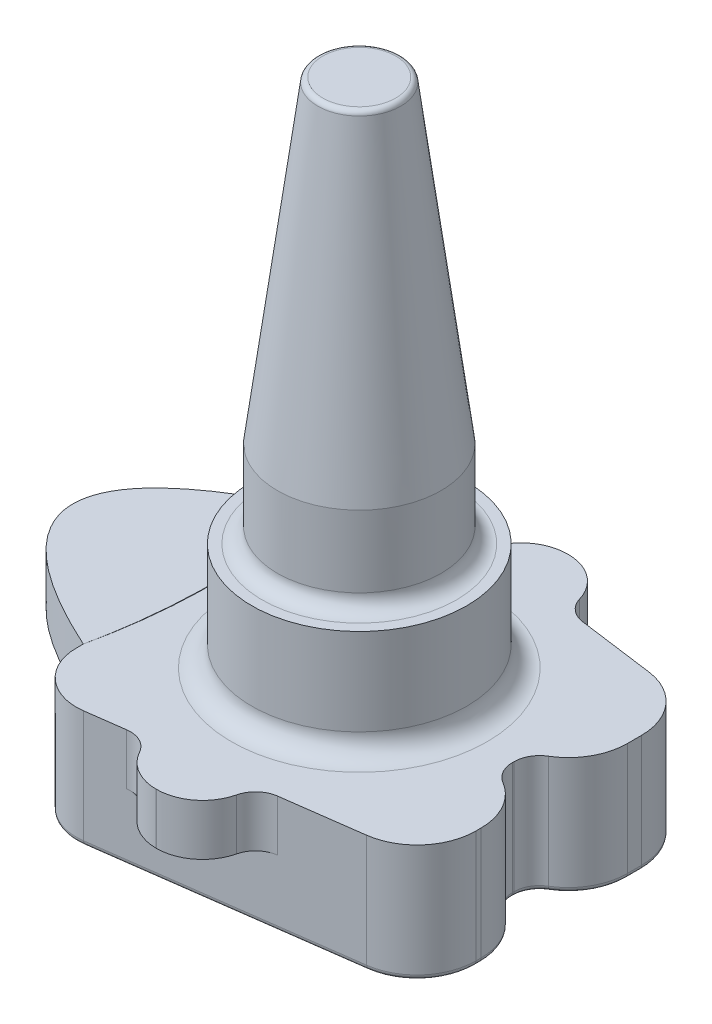
from build123d import *

# Parameters (mm, degrees)
ESBO_O2_OUTSIDE_W        = 213.508
ESBO_O2_OUTSIDE_H        = 213.508
CORTE_EXTRUS_O2_DEPTH    = 177.104428981
ESBO_O3_R                = 106.5
CORTE_EXTRUS_O3_DEPTH    = 140.951031327
FILETE1_R                = 10
ESBO_O4_W                = 8
ESBO_O4_H                = 4.25
CORTE_EXTRUS_O4_DEPTH    = 140.587965081
FILETE2_R                = 11.5
FILETE3_R                = 11.5
FILETE4_R                = 5
FILETE5_R                = 5
FILETE6_R                = 11.5
FILETE7_R                = 4
FILETE8_R                = 3
FILETE10_R               = 1
ESBO_O5_R                = 20.5
CORTE_EXTRUS_O6_DEPTH    = 2.5
CHANFRO1_SIZE            = 2
ESBO_O6_W                = 10
ESBO_O6_H                = 20
CORTE_EXTRUS_O7_DEPTH    = 10
CHANFRO2_SIZE            = 1
RESSALTO_EXTRUS_O2_DEPTH = 23
CORTE_EXTRUS_O10_DEPTH   = 13
CORTE_EXTRUS_O11_DEPTH   = 13
FILETE11_R               = 9
FILETE12_R               = 5
FILETE15_R               = 5
FILETE16_R               = 9
FILETE17_R               = 5
FILETE18_R               = 5
RESSALTO_EXTRUS_O4_DEPTH = 23
CORTE_EXTRUS_O12_DEPTH   = 13
FILETE20_R               = 1


with BuildPart() as part:
    # Esboço1 → Revolução1 (revolve)
    with BuildSketch(Plane.XY, mode=Mode.PRIVATE) as revolu_o1_sk:
        Polygon((17.384649235, 86.73567042), (25.384649235, 86.73567042), (33.384649235, 24.73567042), (33.384649235, 7.73567042), (38.384649235, 7.73567042), (38.384649235, -13.26432958), (97.384649235, -13.26432958), (97.384649235, -36.26432958), (17.384649235, -36.26432958), align=None)
    revolve(revolu_o1_sk.sketch.rotate(Axis((17.384649235, 86.73567042, 0), (0, -1, 0)), 180), axis=Axis((17.384649235, 86.73567042, 0), (0, -1, 0)))

    # Esboço2 outside → Corte-extrusão2 (cut, through all)
    with BuildSketch(Plane.XZ.offset(36.26432958)):
        with Locations((17.385, 0)):
            Rectangle(ESBO_O2_OUTSIDE_W, ESBO_O2_OUTSIDE_H)
        Polygon((56.384649235, 26.25), (56.384649235, -26.25), (-13.615350765, -35.75), (-13.615350765, 35.75), align=None, mode=Mode.SUBTRACT)
    extrude(amount=-CORTE_EXTRUS_O2_DEPTH, mode=Mode.SUBTRACT)

    # Esboço3 → Corte-extrusão3 (cut, through all)
    with BuildSketch(Plane.XZ.offset(36.26432958)):
        with Locations((-117.615350765, 0)):
            Circle(ESBO_O3_R)
    extrude(amount=-CORTE_EXTRUS_O3_DEPTH, mode=Mode.SUBTRACT)

    # Filete1
    filete1_edges = [part.edges().sort_by_distance(p)[0] for p in [
        (-13.615350765, -24.76432958, -35.75),
        (-13.615350765, -24.76432958, 35.75),
    ]]
    fillet(filete1_edges, radius=FILETE1_R)

    # Esboço4 → Corte-extrusão4 (cut, through all)
    with BuildSketch(Plane.XZ.offset(36.26432958)):
        with Locations((52.384649235, 2.125)):
            Rectangle(ESBO_O4_W, ESBO_O4_H)
        with Locations((52.384649235, -2.125)):
            Rectangle(ESBO_O4_W, ESBO_O4_H)
    extrude(amount=-CORTE_EXTRUS_O4_DEPTH, mode=Mode.SUBTRACT)

    # Filete2
    filete2_edges = [part.edges().sort_by_distance(p)[0] for p in [
        (56.384649235, -24.76432958, 26.25),
    ]]
    fillet(filete2_edges, radius=FILETE2_R)

    # Filete3
    # the kernel refuses this fillet: 11.5 mm, written as the material it takes off along each edge
    with BuildSketch(Plane(origin=(56.384649235, -63.650457456, 4.25), x_dir=(0, 0, 1), z_dir=(0, 1, 0))) as filete3_piece_1:
        with BuildLine():
            CenterArc((10.95445115, -11.5), FILETE3_R, 90, 72.281068127)
            Line((0, -8), (-0.219089023, -7.93))
            ThreePointArc((-0.219089023, -7.93), (-0.23, -4), (-0.23, 0))
            Line((-0.23, 0), (0, 0.23))
            Line((0, 0.23), (10.95445115, 0.23))
            Line((10.95445115, 0.23), (10.95445115, 0))
        make_face()
    extrude(amount=77.772255751, mode=Mode.SUBTRACT)

    # Filete4
    filete4_edges = [part.edges().sort_by_distance(p)[0] for p in [
        (48.384649235, -24.76432958, 4.25),
    ]]
    fillet(filete4_edges, radius=FILETE4_R)

    # Filete5
    filete5_edges = [part.edges().sort_by_distance(p)[0] for p in [
        (48.384649235, -24.76432958, -4.25),
    ]]
    fillet(filete5_edges, radius=FILETE5_R)

    # Filete6
    filete6_edges = [part.edges().sort_by_distance(p)[0] for p in [
        (56.384649235, -24.76432958, -26.25),
        (56.384649235, -24.76432958, -4.25),
    ]]
    fillet(filete6_edges, radius=FILETE6_R)

    # Filete7
    filete7_edges = [part.edges().sort_by_distance(p)[0] for p in [
        (38.384649235, -13.26432958, 0),
    ]]
    fillet(filete7_edges, radius=FILETE7_R)

    # Filete8
    filete8_edges = [part.edges().sort_by_distance(p)[0] for p in [
        (33.384649235, 7.73567042, 0),
    ]]
    fillet(filete8_edges, radius=FILETE8_R)

    # Filete10
    filete10_edges = [part.edges().sort_by_distance(p)[0] for p in [
        (54.894114452, -36.26432958, 9.542242565),
        (49.032707836, -36.26432958, 3.524145346),
        (56.384649235, -36.26432958, -14.798713755),
        (49.032707836, -36.26432958, -1.71182982),
        (54.894114452, -36.26432958, -7.729927039),
        (53.545918618, -36.26432958, -23.770502568),
        (-13.615350765, -36.26432958, -23.620662492),
        (-11.115350765, -36.26432958, 0),
        (-13.615350765, -36.26432958, 23.620662492),
        (22.080325057, -36.26432958, -30.905586853),
        (-10.193794837, -36.26432958, 31.832724085),
        (-10.193794837, -36.26432958, -31.832724085),
        (22.080325057, -36.26432958, 30.905586853),
        (53.545918618, -36.26432958, 23.770502568),
        (56.384649235, -36.26432958, 15.704871518),
        (48.384649235, -36.26432958, 0.906157763),
    ]]
    fillet(filete10_edges, radius=FILETE10_R)

    # Esboço5 → Corte-extrusão6 (cut)
    with BuildSketch(Plane.XZ.offset(36.26432958)):
        with Locations((18.634649235, 0.375)):
            Circle(ESBO_O5_R)
    extrude(amount=-CORTE_EXTRUS_O6_DEPTH, mode=Mode.SUBTRACT)

    # Chanfro1
    chanfro1_edges = [part.edges().sort_by_distance(p)[0] for p in [
        (-1.865350765, -33.76432958, 0.375),
    ]]
    chamfer(chanfro1_edges, length=CHANFRO1_SIZE)

    # Esboço6 → Corte-extrusão7 (cut)
    with BuildSketch(Plane.XZ.offset(33.76432958)):
        with Locations((18.634649235, 0.375)):
            Rectangle(ESBO_O6_W, ESBO_O6_H)
    extrude(amount=-CORTE_EXTRUS_O7_DEPTH, mode=Mode.SUBTRACT)

    # Chanfro2
    chanfro2_edges = [part.edges().sort_by_distance(p)[0] for p in [
        (13.634649235, -33.76432958, 0.375),
        (18.634649235, -33.76432958, -9.625),
        (23.634649235, -33.76432958, 0.375),
        (18.634649235, -33.76432958, 10.375),
    ]]
    chamfer(chanfro2_edges, length=CHANFRO2_SIZE)

    # Esboço7 → Ressalto-extrusão2 (add)
    with BuildSketch(Plane.XZ.offset(36.26432958)):
        Polygon((9.142306031, 40.375), (27.142306031, 40.375), (27.142306031, 30.218603721), (9.142306031, 32.661460863), align=None)
        Polygon((9.634649235, -39.625), (27.634649235, -39.625), (27.634649235, -30.151785714), (9.634649235, -32.594642857), align=None)
    extrude(amount=-RESSALTO_EXTRUS_O2_DEPTH)

    # Esboço8 → Corte-extrusão10 (cut)
    with BuildSketch(Plane.XZ.offset(36.26432958)):
        Polygon((27.142306031, 40.375), (9.142306031, 40.375), (9.142306031, 32.661460863), (27.142306031, 30.218603721), align=None)
    extrude(amount=-CORTE_EXTRUS_O10_DEPTH, mode=Mode.SUBTRACT)

    # Esboço9 → Corte-extrusão11 (cut)
    with BuildSketch(Plane.XZ.offset(36.26432958)):
        Polygon((9.634649235, -32.594642857), (9.634649235, -45.906796795), (27.980618012, -45.906796795), (27.634649235, -30.151785714), align=None)
    extrude(amount=-CORTE_EXTRUS_O11_DEPTH, mode=Mode.SUBTRACT)

    # Filete11
    # the kernel refuses this fillet: 9 mm, written as the material it takes off along each edge
    with BuildSketch(Plane(origin=(9.142306031, -45.533284771, 40.375), x_dir=(1, 0, 0), z_dir=(0, 1, 0))) as filete11_piece_1:
        with BuildLine():
            CenterArc((8.907582076, 9), FILETE11_R, 188.218012846, 81.781987154)
            Line((0, 7.713539137), (-0.178151642, 7.687809919))
            ThreePointArc((-0.178151642, 7.687809919), (-0.18, 3.856769568), (-0.18, 0))
            Line((-0.18, 0), (0, -0.18))
            Line((0, -0.18), (8.907582076, -0.18))
            Line((8.907582076, -0.18), (8.907582076, 0))
        make_face()
    extrude(amount=54.537910382, mode=Mode.SUBTRACT)
    with BuildSketch(Plane(origin=(27.142306031, -45.76432958, 40.375), x_dir=(0, 0, -1), z_dir=(0, 1, 0))) as filete11_piece_2:
        with BuildLine():
            CenterArc((FILETE11_R, FILETE11_R), FILETE11_R, 180, 90)
            Line((0, FILETE11_R), (-FILETE11_R * 0.02, FILETE11_R))
            Line((-FILETE11_R * 0.02, FILETE11_R), (-FILETE11_R * 0.02, -FILETE11_R * 0.02))
            Line((-FILETE11_R * 0.02, -FILETE11_R * 0.02), (FILETE11_R, -FILETE11_R * 0.02))
            Line((FILETE11_R, -FILETE11_R * 0.02), (FILETE11_R, 0))
        make_face()
    extrude(amount=55, mode=Mode.SUBTRACT)

    # Filete12
    # the kernel refuses this fillet: 5 mm, written as the material it adds along each edge
    with BuildSketch(Plane(origin=(27.142306031, -23.26432958, 30.218603721), x_dir=(0.9909161083213732, 0, -0.13448147184361356), z_dir=(0, 1, 0))) as filete12_piece_1:
        with BuildLine():
            CenterArc((3.9781158, -5), FILETE12_R, 90, 68.792548133)
            Line((-0.683268003, -3.191270877), (-1.149406384, -3.010397964))
            ThreePointArc((-1.149406384, -3.010397964), (-0.650971928, -1.078650965), (-0.495458054, 0.067240736))
            Line((-0.495458054, 0.067240736), (0, 0.5))
            Line((0, 0.5), (3.9781158, 0.5))
            Line((3.9781158, 0.5), (3.9781158, 0))
        make_face()
    extrude(amount=10)

    # Filete15
    filete15_edges = [part.edges().sort_by_distance(p)[0] for p in [
        (9.142306031, -18.26432958, 32.661460863),
    ]]
    fillet(filete15_edges, radius=FILETE15_R)

    # Filete16
    # the kernel refuses this fillet: 9 mm, written as the material it takes off along each edge
    with BuildSketch(Plane(origin=(9.634649235, -45.218900149, -39.625), x_dir=(1, 0, 0), z_dir=(0, 1, 0))) as filete16_piece_1:
        with BuildLine():
            CenterArc((8.781828227, -9), FILETE16_R, 90, 77.358549655)
            Line((0, -7.030357143), (-0.175636565, -6.990964286))
            ThreePointArc((-0.175636565, -6.990964286), (-0.18, -3.515178571), (-0.18, 0))
            Line((-0.18, 0), (0, 0.18))
            Line((0, 0.18), (8.781828227, 0.18))
            Line((8.781828227, 0.18), (8.781828227, 0))
        make_face()
    extrude(amount=53.909141137, mode=Mode.SUBTRACT)
    with BuildSketch(Plane(origin=(27.634649235, -45.76432958, -39.625), x_dir=(0, 0, 1), z_dir=(0, 1, 0))) as filete16_piece_2:
        with BuildLine():
            CenterArc((FILETE16_R, -FILETE16_R), FILETE16_R, 90, 90)
            Line((0, -FILETE16_R), (-FILETE16_R * 0.02, -FILETE16_R))
            Line((-FILETE16_R * 0.02, -FILETE16_R), (-FILETE16_R * 0.02, FILETE16_R * 0.02))
            Line((-FILETE16_R * 0.02, FILETE16_R * 0.02), (FILETE16_R, FILETE16_R * 0.02))
            Line((FILETE16_R, FILETE16_R * 0.02), (FILETE16_R, 0))
        make_face()
    extrude(amount=55, mode=Mode.SUBTRACT)

    # Filete17
    # the kernel refuses this fillet: 5 mm, written as the material it adds along each edge
    with BuildSketch(Plane(origin=(27.634649235, -23.26432958, -30.151785714), x_dir=(0.990916108321373, 0, 0.13448147184361506), z_dir=(0, 1, 0))) as filete17_piece_1:
        with BuildLine():
            CenterArc((3.786676456, 5), FILETE17_R, 204.211195722, 65.788804278)
            Line((-0.773523538, 2.949493719), (-1.229543538, 2.74444309))
            ThreePointArc((-1.229543538, 2.74444309), (-0.559096608, 0.401674922), (-0.495458054, -0.067240736))
            Line((-0.495458054, -0.067240736), (0, -0.5))
            Line((0, -0.5), (3.786676456, -0.5))
            Line((3.786676456, -0.5), (3.786676456, 0))
        make_face()
    extrude(amount=10)

    # Filete18
    filete18_edges = [part.edges().sort_by_distance(p)[0] for p in [
        (9.634649235, -18.26432958, -32.594642857),
    ]]
    fillet(filete18_edges, radius=FILETE18_R)

    # Filete20
    filete20_edges = [part.edges().sort_by_distance(p)[0] for p in [
        (25.384649235, 86.73567042, 0),
    ]]
    fillet(filete20_edges, radius=FILETE20_R)


with BuildPart() as body_2:
    # Esboço10 → Ressalto-extrusão4 (new body)
    with BuildSketch(Plane.XZ.offset(36.26432958)):
        with BuildLine():
            add(Edge.make_bspline(
                [(-13.615350765, 22.940139494), (-63.118175141, 0.403467916), (-13.615350765, -22.940139494)],
                knots=[0, 0, 0, 1, 1, 1], degree=2))
            add(Edge.make_bspline(
                [(-13.615350765, 22.940139494), (-8.785086194, 0.008221789), (-13.615350765, -22.940139494)],
                knots=[0, 0, 0, 1, 1, 1], degree=2))
        make_face()
    extrude(amount=-RESSALTO_EXTRUS_O4_DEPTH)

    # Esboço11 → Corte-extrusão12 (cut)
    with BuildSketch(Plane.XZ.offset(36.26432958)):
        with BuildLine():
            Line((-13.615350765, -22.940139494), (-48.355653305, -22.940139494))
            Line((-48.355653305, -22.940139494), (-48.355653305, 22.940139494))
            Line((-48.355653305, 22.940139494), (-13.615350765, 22.940139494))
            add(Edge.make_bspline(
                [(-13.615350765, 22.940139494), (-8.651158456, 0), (-13.615350765, -22.940139494)],
                knots=[0, 0, 0, 1, 1, 1], degree=2))
        make_face()
    extrude(amount=-CORTE_EXTRUS_O12_DEPTH, mode=Mode.SUBTRACT)


solid = Compound([part.part, body_2.part])
